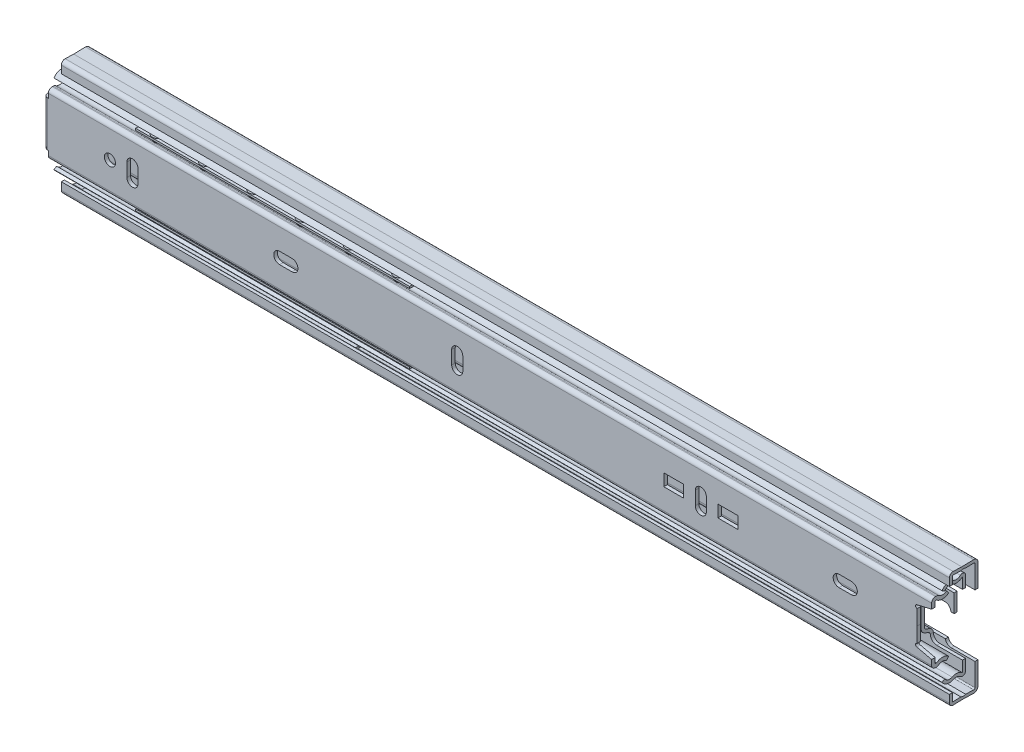
from build123d import *
from build123d.topology import SkipClean

# Parameters (mm, degrees)
EXTRUDE1_DEPTH      = 175.006
MIDDLE_MEMBER_DEPTH = 350.012
DRAWER_START        = -350.012
DRAWER_MEMBER_DEPTH = 350.012
SKETCH6_W           = 1.905
SKETCH6_H           = 12.147486483
CUT_EXTRUDE1_DEPTH  = 183.472714881
EXTRUDE4_DEPTH      = 8.89
CUT_EXTRUDE2_DEPTH  = 1.1938
CUT_EXTRUDE3_DEPTH  = 1.397
CUT_EXTRUDE4_DEPTH  = 183.160321891
CUT_EXTRUDE5_DEPTH  = 1.1938
CUT_EXTRUDE14_DEPTH = 1.1938
CUT_EXTRUDE6_DEPTH  = 1.1938
CUT_E_DEPTH         = 1.1938
SKETCH24_R          = 2.1844
CUT_EXTRUDE13_DEPTH = 1.397
CUT_D_DEPTH         = 1.397
SKETCH38_W          = 7.874
SKETCH38_H          = 2.3749
CUT_A_DEPTH         = 1.397
LPATTERN1_COUNT     = 6
LPATTERN1_PITCH     = 19.05
EXTRUDE7_DEPTH      = 6.35
EXTRUDE7_DEPTH_BACK = 101.6
SKETCH28_W          = 7.62
SKETCH28_H          = 0.762
LPATTERN2_COUNT     = 6
LPATTERN2_PITCH     = 19.05
EXTRUDE8_DEPTH      = 6.35
EXTRUDE8_DEPTH_BACK = 101.6
SKETCH30_W          = 5.08
SKETCH30_H          = 0.762


# Read off the part's stored shape, not the designer's step: Drawer Member
with BuildPart() as part:
    # Sketch1 → Extrude1 (new, symmetric)
    with BuildSketch(Plane(origin=(0, 0, 0), x_dir=(0, 0, -1), z_dir=(1, 0, 0))):
        with BuildLine():
            Line((-4.139279899, 22.8203125), (-0.743323143, 22.698920454))
            Line((-0.743323143, 22.698920454), (3.892452069, 22.8203125))
            ThreePointArc((3.892452069, 22.8203125), (5.124499805, 22.338098312), (5.6388, 21.119095664))
            Line((5.6388, 21.119095664), (5.6388, 0))
            Line((5.6388, 0), (4.445, 0))
            Line((4.445, 0), (4.445, 21.119095664))
            ThreePointArc((4.445, 21.119095664), (4.291477554, 21.482977052), (3.92370211, 21.626921585))
            Line((3.92370211, 21.626921585), (0.761857041, 21.544125758))
            ThreePointArc((0.761857041, 21.544125758), (-0.187154328, 21.71413397), (-1.131158407, 21.51822157))
            Line((-1.131158407, 21.51822157), (-4.181926298, 21.627274477))
            ThreePointArc((-4.181926298, 21.627274477), (-4.367367911, 21.55622161), (-4.445, 21.3734366))
            Line((-4.445, 21.3734366), (-4.445, 18.415))
            Line((-4.445, 18.415), (-5.6388, 18.415))
            Line((-5.6388, 18.415), (-5.6388, 21.3734366))
            ThreePointArc((-5.6388, 21.3734366), (-5.19629709, 22.415311161), (-4.139279899, 22.8203125))
        make_face()
    extrude(amount=EXTRUDE1_DEPTH, both=True)

    # Sketch8 → Cut-Extrude2 (cut)
    with BuildSketch(Plane.XY.offset(-4.445)):
        with BuildLine():
            Line((165.367533997, 7.645578895), (166.8018, 7.493000005))
            Line((166.8018, 7.493000005), (166.8018, 0))
            Line((166.8018, 0), (175.006, 0))
            Line((175.006, 0), (175.006, 12.204752384))
            Line((175.006, 12.204752384), (165.609356843, 12.204752384))
            ThreePointArc((165.609356843, 12.204752384), (163.326565723, 10.03983377), (165.367533997, 7.645578895))
        make_face()
    extrude(amount=-CUT_EXTRUDE2_DEPTH, mode=Mode.SUBTRACT)

    # Sketch13 → Cut-Extrude5 (cut)
    with BuildSketch(Plane.XY.offset(-4.445)):
        with BuildLine():
            Line((-106.617699917, 7.112000069), (-131.446199931, 7.112000069))
            ThreePointArc((-131.446199931, 7.112000069), (-131.985015347, 6.888815416), (-132.2082, 6.35))
            Line((-132.2082, 6.35), (-132.2082, 0))
            Line((-132.2082, 0), (-134.4942, 0))
            Line((-134.4942, 0), (-134.4942, 6.35))
            ThreePointArc((-134.4942, 6.35), (-134.717384653, 6.888815416), (-135.256200069, 7.112000069))
            Line((-135.256200069, 7.112000069), (-157.544699917, 7.112000069))
            ThreePointArc((-157.544699917, 7.112000069), (-159.132199917, 8.699500069), (-157.544699917, 10.287000069))
            Line((-157.544699917, 10.287000069), (-106.617699917, 10.287000069))
            ThreePointArc((-106.617699917, 10.287000069), (-105.030199917, 8.699500069), (-106.617699917, 7.112000069))
        make_face()
        with BuildLine():
            Line((-112.231099917, 2.286), (-117.184099917, 2.286))
            ThreePointArc((-117.184099917, 2.286), (-118.800546018, 1.616446102), (-119.470099917, 0))
            Line((-119.470099917, 0), (-109.945099917, 0))
            ThreePointArc((-109.945099917, 0), (-110.614653815, 1.616446102), (-112.231099917, 2.286))
        make_face()
        with BuildLine():
            Line((-151.283599917, 0), (-146.711599917, 0))
            ThreePointArc((-146.711599917, 0), (-148.997599917, 2.286), (-151.283599917, 0))
        make_face()
        with BuildLine():
            Line((-143.181000083, 0), (-136.830999917, 0))
            ThreePointArc((-136.830999917, 0), (-140.006, 3.175000083), (-143.181000083, 0))
        make_face()
        with BuildLine():
            Line((-129.693599917, 0), (-125.121599917, 0))
            ThreePointArc((-125.121599917, 0), (-127.407599917, 2.286), (-129.693599917, 0))
        make_face()
    extrude(amount=-CUT_EXTRUDE5_DEPTH, mode=Mode.SUBTRACT)

    # Sketch32 → Cut-Extrude14 (cut)
    with BuildSketch(Plane(origin=(0, 0, -5.6388), x_dir=(-1, 0, 0), z_dir=(0, 0, -1))):
        with BuildLine():
            Line((-5.4565, 0), (4.0685, 0))
            ThreePointArc((4.0685, 0), (3.398946102, 1.616446102), (1.7825, 2.286))
            Line((1.7825, 2.286), (-3.1705, 2.286))
            ThreePointArc((-3.1705, 2.286), (-4.786946102, 1.616446102), (-5.4565, 0))
        make_face()
        with BuildLine():
            Line((8.831, 0), (15.181, 0))
            ThreePointArc((15.181, 0), (12.006, 3.175), (8.831, 0))
        make_face()
        with BuildLine():
            Line((18.6735, 0), (28.1985, 0))
            ThreePointArc((28.1985, 0), (27.528946102, 1.616446102), (25.9125, 2.286))
            Line((25.9125, 2.286), (20.9595, 2.286))
            ThreePointArc((20.9595, 2.286), (19.343053898, 1.616446102), (18.6735, 0))
        make_face()
        with BuildLine():
            Line((31.564, 0), (36.136, 0))
            Line((36.136, 0), (36.136, 8.763000069))
            ThreePointArc((36.136, 8.763000069), (35.689630735, 9.840630803), (34.612, 10.287000069))
            Line((34.612, 10.287000069), (-8.6315, 10.287000069))
            ThreePointArc((-8.6315, 10.287000069), (-10.219, 8.699500069), (-8.6315, 7.112000069))
            Line((-8.6315, 7.112000069), (30.04, 7.112000069))
            ThreePointArc((30.04, 7.112000069), (31.117630735, 6.665630803), (31.564, 5.588000069))
            Line((31.564, 5.588000069), (31.564, 0))
        make_face()
    extrude(amount=-CUT_EXTRUDE14_DEPTH, mode=Mode.SUBTRACT)

    # Sketch33 → Cut-Extrude6 (cut)
    with BuildSketch(Plane(origin=(83.609365602, 0.812450965, -5.6388), x_dir=(-1, 0, 0), z_dir=(0, 0, -1))):
        with BuildLine():
            Line((-17.847134398, -0.812450965), (-8.322134398, -0.812450965))
            ThreePointArc((-8.322134398, -0.812450965), (-8.991688296, 0.803995136), (-10.608134398, 1.473549035))
            Line((-10.608134398, 1.473549035), (-15.561134398, 1.473549035))
            ThreePointArc((-15.561134398, 1.473549035), (-17.1775805, 0.803995136), (-17.847134398, -0.812450965))
        make_face()
        with BuildLine():
            Line((-3.559634398, -0.812450965), (2.790365602, -0.812450965))
            ThreePointArc((2.790365602, -0.812450965), (-0.384634398, 2.362549035), (-3.559634398, -0.812450965))
        make_face()
        with BuildLine():
            Line((6.282865602, -0.812450965), (15.807865602, -0.812450965))
            ThreePointArc((15.807865602, -0.812450965), (15.138311704, 0.803995136), (13.521865602, 1.473549035))
            Line((13.521865602, 1.473549035), (8.568865602, 1.473549035))
            ThreePointArc((8.568865602, 1.473549035), (6.9524195, 0.803995136), (6.282865602, -0.812450965))
        make_face()
        with BuildLine():
            Line((19.173365602, -0.812450965), (23.745365602, -0.812450965))
            Line((23.745365602, -0.812450965), (23.745365602, 7.950549103))
            ThreePointArc((23.745365602, 7.950549103), (23.298996337, 9.028179838), (22.221365602, 9.474549103))
            Line((22.221365602, 9.474549103), (-21.022134398, 9.474549103))
            ThreePointArc((-21.022134398, 9.474549103), (-22.609634398, 7.887049103), (-21.022134398, 6.299549103))
            Line((-21.022134398, 6.299549103), (17.649365602, 6.299549103))
            ThreePointArc((17.649365602, 6.299549103), (18.726996337, 5.853179838), (19.173365602, 4.775549103))
            Line((19.173365602, 4.775549103), (19.173365602, -0.812450965))
        make_face()
    extrude(amount=-CUT_EXTRUDE6_DEPTH, mode=Mode.SUBTRACT)

    # Sketch34 → Cut E (cut)
    with BuildSketch(Plane(origin=(169.823604257, 1.452669916, -5.6388), x_dir=(-1, 0, 0), z_dir=(0, 0, -1))):
        with BuildLine():
            Line((4.331104257, -1.452669916), (13.856104257, -1.452669916))
            ThreePointArc((13.856104257, -1.452669916), (13.186550358, 0.163776186), (11.570104257, 0.833330084))
            Line((11.570104257, 0.833330084), (6.617104257, 0.833330084))
            ThreePointArc((6.617104257, 0.833330084), (5.000658155, 0.163776186), (4.331104257, -1.452669916))
        make_face()
        with BuildLine():
            Line((18.618604257, -1.452669916), (24.968604257, -1.452669916))
            ThreePointArc((24.968604257, -1.452669916), (21.793604257, 1.722330084), (18.618604257, -1.452669916))
        make_face()
        with BuildLine():
            Line((28.461104257, -1.452669916), (37.986104257, -1.452669916))
            ThreePointArc((37.986104257, -1.452669916), (37.316550358, 0.163776186), (35.700104257, 0.833330084))
            Line((35.700104257, 0.833330084), (30.747104257, 0.833330084))
            ThreePointArc((30.747104257, 0.833330084), (29.130658155, 0.163776186), (28.461104257, -1.452669916))
        make_face()
        with BuildLine():
            Line((41.351604257, -1.452669916), (45.923604257, -1.452669916))
            Line((45.923604257, -1.452669916), (45.923604257, 7.310330153))
            ThreePointArc((45.923604257, 7.310330153), (45.477234991, 8.387960887), (44.399604257, 8.834330153))
            Line((44.399604257, 8.834330153), (1.156104257, 8.834330153))
            ThreePointArc((1.156104257, 8.834330153), (-0.431395743, 7.246830153), (1.156104257, 5.659330153))
            Line((1.156104257, 5.659330153), (39.827604257, 5.659330153))
            ThreePointArc((39.827604257, 5.659330153), (40.905234991, 5.212960887), (41.351604257, 4.135330153))
            Line((41.351604257, 4.135330153), (41.351604257, -1.452669916))
        make_face()
    extrude(amount=-CUT_E_DEPTH, mode=Mode.SUBTRACT)


with BuildPart() as body_2:
    # Sketch2 → Middle Member (new body)
    with BuildSketch(Plane.ZY.offset(177.8)):
        with BuildLine():
            ThreePointArc((5.7404, 15.627692517), (3.735864231, 17.127444277), (1.241474216, 16.914283663))
            ThreePointArc((1.241474216, 16.914283663), (-0.188944013, 16.688900955), (-1.505642365, 17.291560999))
            ThreePointArc((-1.505642365, 17.291560999), (-2.813430342, 17.487614783), (-3.53059999, 16.376572852))
            Line((-3.53059999, 16.376572852), (-3.53059999, 9.521737984))
            ThreePointArc((-3.53059999, 9.521737984), (-3.220327109, 8.457239952), (-2.386691239, 7.726160915))
            Line((-2.386691239, 7.726160915), (-0.414564934, 6.806543316))
            ThreePointArc((-0.414564934, 6.806543316), (-0.093935732, 6.525359052), (0.0254, 6.115936705))
            Line((0.0254, 6.115936705), (0.0254, 0))
            Line((0.0254, 0), (1.2446, 0))
            Line((1.2446, 0), (1.2446, 6.115936705))
            ThreePointArc((1.2446, 6.115936705), (0.934327119, 7.180434735), (0.100691251, 7.91151377))
            Line((0.100691251, 7.91151377), (-1.871435054, 8.831131369))
            ThreePointArc((-1.871435054, 8.831131369), (-2.192064258, 9.112315634), (-2.31139999, 9.521737984))
            Line((-2.31139999, 9.521737984), (-2.31139999, 16.376572852))
            ThreePointArc((-2.31139999, 16.376572852), (-2.311399987, 16.376572856), (-2.311399982, 16.376572855))
            ThreePointArc((-2.311399982, 16.376572855), (-0.35482671, 15.481038557), (1.770730805, 15.815950333))
            ThreePointArc((1.770730805, 15.815950333), (3.400639083, 15.955235789), (4.710462095, 14.975253591))
            Line((4.710462095, 14.975253591), (5.7404, 15.627692517))
        make_face()
    extrude(amount=-MIDDLE_MEMBER_DEPTH)

    # Sketch12 → Cut-Extrude4 (cut, through all)
    with BuildSketch(Plane.XY.offset(1.2446)):
        with BuildLine():
            Line((172.212, 12.065), (162.052, 12.065))
            ThreePointArc((162.052, 12.065), (160.255948776, 11.321051224), (159.512, 9.525))
            Line((159.512, 9.525), (159.512, 0))
            Line((159.512, 0), (172.212, 0))
            Line((172.212, 0), (172.212, 12.065))
        make_face()
    extrude(amount=-CUT_EXTRUDE4_DEPTH, mode=Mode.SUBTRACT)

    # Mirror3: body 2 across plane


with BuildPart() as body_3:
    # Drawer Member outline → Drawer Member (new body)
    with BuildSketch(Plane.ZY.offset(180.594).offset(DRAWER_START)):
        with BuildLine():
            Line((5.6642, 0), (7.0612, 0))
            Line((7.0612, 0), (7.0612, 10.623486483))
            ThreePointArc((7.0612, 10.623486483), (6.614830734, 11.701117218), (5.5372, 12.147486483))
            Line((5.5372, 12.147486483), (5.164341455, 12.147486483))
            ThreePointArc((5.164341455, 12.147486483), (4.67440708, 12.066587417), (4.236487447, 11.83247901))
            ThreePointArc((4.236487447, 11.83247901), (2.709144677, 11.334862777), (1.208194452, 11.907179363))
            Line((1.208194452, 11.907179363), (0.304054167, 10.842219578))
            ThreePointArc((0.304054167, 10.842219578), (2.674694689, 9.938287609), (5.087020295, 10.724235863))
            ThreePointArc((5.087020295, 10.724235863), (5.123513594, 10.743744895), (5.164341455, 10.750486483))
            Line((5.164341455, 10.750486483), (5.5372, 10.750486483))
            ThreePointArc((5.5372, 10.750486483), (5.627002561, 10.713289044), (5.6642, 10.623486483))
            Line((5.6642, 10.623486483), (5.6642, 0))
        make_face()
    extrude(amount=DRAWER_MEMBER_DEPTH)

    # Sketch6 → Cut-Extrude1 (cut, through all)
    with BuildSketch(Plane.XY.offset(7.0612)):
        with Locations((-179.6415, 6.073743242)):
            Rectangle(SKETCH6_W, SKETCH6_H)
    extrude(amount=-CUT_EXTRUDE1_DEPTH, mode=Mode.SUBTRACT)

    # Sketch7 → Extrude4 (add)
    with BuildSketch(Plane.XZ):
        with BuildLine():
            Line((-178.689, 7.0612), (-178.943, 7.0612))
            ThreePointArc((-178.943, 7.0612), (-180.110433296, 6.577633296), (-180.594, 5.4102))
            Line((-180.594, 5.4102), (-180.594, 0.304054167))
            Line((-180.594, 0.304054167), (-179.197, 0.304054167))
            Line((-179.197, 0.304054167), (-179.197, 5.4102))
            ThreePointArc((-179.197, 5.4102), (-179.122605122, 5.589805122), (-178.943, 5.6642))
            Line((-178.943, 5.6642), (-178.689, 5.6642))
            Line((-178.689, 5.6642), (-178.689, 7.0612))
        make_face()
    extrude(amount=-EXTRUDE4_DEPTH)

    # Sketch11 → Cut-Extrude3 (cut)
    with BuildSketch(Plane.XY.offset(7.0612)):
        with BuildLine():
            Line((163.703048602, 5.967847879), (163.703, 0))
            Line((163.703, 0), (169.418, 0))
            Line((169.418, 0), (169.418, 8.589285844))
            Line((169.418, 8.589285844), (163.558673543, 7.221216084))
            ThreePointArc((163.558673543, 7.221216084), (163.072225152, 6.530182899), (163.703048602, 5.967847879))
        make_face()
    extrude(amount=-CUT_EXTRUDE3_DEPTH, mode=Mode.SUBTRACT)

    # Sketch24 → Cut-Extrude13 (cut)
    with BuildSketch(Plane.XY.offset(7.0612)):
        with Locations((-154.432, 0)):
            Circle(SKETCH24_R)
        with BuildLine():
            Line((-147.7264, 2.6416), (-147.7264, 0))
            Line((-147.7264, 0), (-143.3576, 0))
            Line((-143.3576, 0), (-143.3576, 2.6416))
            ThreePointArc((-143.3576, 2.6416), (-145.542, 4.826), (-147.7264, 2.6416))
        make_face()
        with BuildLine():
            Line((-89.8525, 0), (-80.3275, 0))
            ThreePointArc((-80.3275, 0), (-80.997053898, 1.616446102), (-82.6135, 2.286))
            Line((-82.6135, 2.286), (-87.5665, 2.286))
            ThreePointArc((-87.5665, 2.286), (-89.182946102, 1.616446102), (-89.8525, 0))
        make_face()
        with BuildLine():
            Line((-19.7264, 2.6416), (-19.7264, 0))
            Line((-19.7264, 0), (-15.3576, 0))
            Line((-15.3576, 0), (-15.3576, 2.6416))
            ThreePointArc((-15.3576, 2.6416), (-17.542, 4.826), (-19.7264, 2.6416))
        make_face()
    extrude(amount=-CUT_EXTRUDE13_DEPTH, mode=Mode.SUBTRACT)

    # Sketch25 → Cut D (cut)
    with BuildSketch(Plane.XY.offset(7.0612)):
        with BuildLine():
            Line((140.1445, 0), (130.6195, 0))
            ThreePointArc((130.6195, 0), (131.289053898, 1.616446102), (132.9055, 2.286))
            Line((132.9055, 2.286), (137.8585, 2.286))
            ThreePointArc((137.8585, 2.286), (139.474946102, 1.616446102), (140.1445, 0))
        make_face()
    extrude(amount=-CUT_D_DEPTH, mode=Mode.SUBTRACT)

    # Sketch38 → Cut A (cut)
    with BuildSketch(Plane.XY.offset(7.0612)):
        with BuildLine():
            Line((76.2736, 0), (76.2736, 2.6416))
            ThreePointArc((76.2736, 2.6416), (78.458, 4.826), (80.6424, 2.6416))
            Line((80.6424, 2.6416), (80.6424, 0))
            Line((80.6424, 0), (76.2736, 0))
        make_face()
        with Locations((89.126, 1.18745)):
            Rectangle(SKETCH38_W, SKETCH38_H)
        with Locations((67.79, 1.18745)):
            Rectangle(SKETCH38_W, SKETCH38_H)
    extrude(amount=-CUT_A_DEPTH, mode=Mode.SUBTRACT)

    # Mirror3 2: body 3 across plane


with BuildPart() as cut_e_piece_1:
    # of the separate pieces the step leaves, piece 1, a body of its own (cut_e_pieces)
    add(part.part.solids().sort_by_distance((-175.006, 22.8203125, 4.139279899))[0])

    # Mirror3 3: Cut E piece 1 across plane


with BuildPart() as cut_e_piece_2:
    # of the separate pieces the step leaves, piece 2, a body of its own (cut_e_pieces)
    add(part.part.solids().sort_by_distance((166.8018, 7.112000069, -5.6388))[0])


with BuildPart() as body_5:
    # Sketch27 → Revolve1 (revolve)
    with BuildSketch(Plane.ZY.offset(162.306)):
        with BuildLine():
            Line((0.1524, 21.683172421), (0.1524, 16.665571078))
            ThreePointArc((0.1524, 16.665571078), (2.661200671, 19.174371749), (0.1524, 21.683172421))
        make_face()
    revolve(axis=Axis((-162.306, 23.635004298, 0.1524), (0, -1, 0)))


with BuildPart() as lpattern1_1:
    # LPattern1: pattern copy
    add(body_5.part.moved(Location(Vector(1, 0, 0) * (1 * LPATTERN1_PITCH))))


with BuildPart() as lpattern1_2:
    # LPattern1: pattern copy
    add(body_5.part.moved(Location(Vector(1, 0, 0) * (2 * LPATTERN1_PITCH))))


with BuildPart() as lpattern1_3:
    # LPattern1: pattern copy
    add(body_5.part.moved(Location(Vector(1, 0, 0) * (3 * LPATTERN1_PITCH))))


with BuildPart() as lpattern1_4:
    # LPattern1: pattern copy
    add(body_5.part.moved(Location(Vector(1, 0, 0) * (4 * LPATTERN1_PITCH))))


with BuildPart() as lpattern1_5:
    # LPattern1: pattern copy
    add(body_5.part.moved(Location(Vector(1, 0, 0) * (5 * LPATTERN1_PITCH))))


with BuildPart() as body_5_1:
    add(body_5.part)

    add(lpattern1_1.part)  # Extrude7 merges LPattern1_1

    add(lpattern1_2.part)  # Extrude7 merges LPattern1_2

    add(lpattern1_3.part)  # Extrude7 merges LPattern1_3

    add(lpattern1_4.part)  # Extrude7 merges LPattern1_4

    add(lpattern1_5.part)  # Extrude7 merges LPattern1_5
    # Sketch28 → Extrude7 (add, two sides: drawn at the far end of the back side and taken through both)
    with BuildSketch(Plane.ZY.offset(162.306).offset(-EXTRUDE7_DEPTH_BACK)):
        with Locations((0.1524, 19.174371749)):
            Rectangle(SKETCH28_W, SKETCH28_H)
    extrude(amount=EXTRUDE7_DEPTH + EXTRUDE7_DEPTH_BACK)


with BuildPart() as body_6:
    # Sketch29 → Revolve2 (revolve)
    with BuildSketch(Plane.ZY.offset(139.7)):
        with BuildLine():
            Line((2.7686, 16.043834368), (2.7686, 11.446434358))
            ThreePointArc((2.7686, 11.446434358), (5.067300005, 13.745134363), (2.7686, 16.043834368))
        make_face()
    revolve(axis=Axis((-139.7, 16.680143034, 2.7686), (0, -1, 0)))


with BuildPart() as lpattern2_1:
    # LPattern2: pattern copy
    add(body_6.part.moved(Location(Vector(1, 0, 0) * (1 * LPATTERN2_PITCH))))


with BuildPart() as lpattern2_2:
    # LPattern2: pattern copy
    add(body_6.part.moved(Location(Vector(1, 0, 0) * (2 * LPATTERN2_PITCH))))


with BuildPart() as lpattern2_3:
    # LPattern2: pattern copy
    add(body_6.part.moved(Location(Vector(1, 0, 0) * (3 * LPATTERN2_PITCH))))


with BuildPart() as lpattern2_4:
    # LPattern2: pattern copy
    add(body_6.part.moved(Location(Vector(1, 0, 0) * (4 * LPATTERN2_PITCH))))


with BuildPart() as lpattern2_5:
    # LPattern2: pattern copy
    add(body_6.part.moved(Location(Vector(1, 0, 0) * (5 * LPATTERN2_PITCH))))


with BuildPart() as body_6_1:
    add(body_6.part)

    add(lpattern2_1.part)  # Extrude8 merges LPattern2_1

    add(lpattern2_2.part)  # Extrude8 merges LPattern2_2

    add(lpattern2_3.part)  # Extrude8 merges LPattern2_3

    add(lpattern2_4.part)  # Extrude8 merges LPattern2_4

    add(lpattern2_5.part)  # Extrude8 merges LPattern2_5
    # Sketch30 → Extrude8 (add, two sides: drawn at the far end of the back side and taken through both)
    with BuildSketch(Plane.ZY.offset(139.7).offset(-EXTRUDE8_DEPTH_BACK)):
        with Locations((2.7686, 13.745134363)):
            Rectangle(SKETCH30_W, SKETCH30_H)
    extrude(amount=EXTRUDE8_DEPTH + EXTRUDE8_DEPTH_BACK)


with BuildPart() as body_2_1:
    add(body_2.part)
    add(body_2.part.mirror(Plane.ZX))


with BuildPart() as body_3_1:
    with SkipClean():  # the faces are left unmerged after this step: merging them gives an invalid solid
        add(body_3.part)
        add(body_3.part.mirror(Plane.ZX))


with BuildPart() as cut_e_piece_1_1:
    with SkipClean():  # the faces are left unmerged after this step: merging them gives an invalid solid
        add(cut_e_piece_1.part)
        add(cut_e_piece_1.part.mirror(Plane.ZX))


with BuildPart() as body_7:
    # Mirror5: mirrored copy
    add(body_6_1.part.mirror(Plane.ZX))


with BuildPart() as body_8:
    # Mirror5 2: mirrored copy
    add(body_5_1.part.mirror(Plane.ZX))


solid = Compound([cut_e_piece_2.part, body_5_1.part, body_6_1.part, body_2_1.part, body_3_1.part, cut_e_piece_1_1.part, body_7.part, body_8.part])
